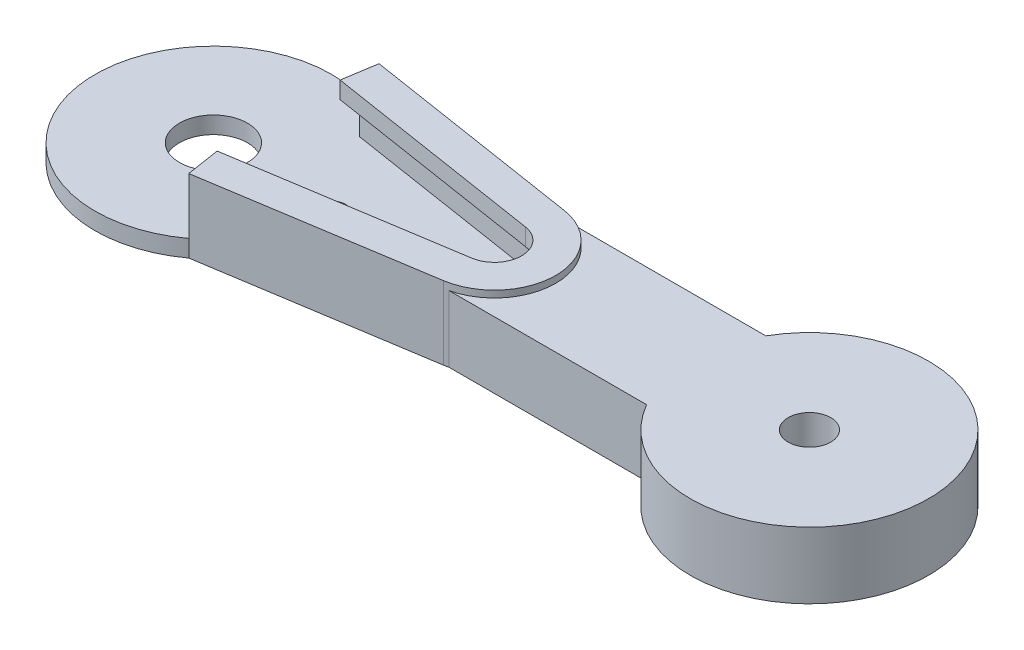
from build123d import *

# Parameters (mm, degrees)
SKETCH2_R           = 6
SKETCH2_R_2         = 1.5
BOSS_EXTRUDE1_DEPTH = 1.15
SKETCH3_R           = 4.4
BOSS_EXTRUDE2_DEPTH = 3.2
SKETCH4_R           = 0.75
BOSS_EXTRUDE3_DEPTH = 1.15
CIRPATTERN1_COUNT   = 2
BOSS_EXTRUDE5_DEPTH = 2.3
SKETCH7_R           = 2
BOSS_EXTRUDE6_DEPTH = 1
SKETCH10_R          = 0.75
CUT_EXTRUDE2_DEPTH  = 23.239726126
CUT_EXTRUDE4_DEPTH  = 2.3
SKETCH13_R          = 4.4
CUT_EXTRUDE5_DEPTH  = 3.3
BOSS_EXTRUDE8_DEPTH = 1
SKETCH14_R          = 1.25
BOSS_EXTRUDE9_DEPTH = 3.9


with BuildPart() as part:
    # Sketch2 → Boss-Extrude1 (new, symmetric)
    with BuildSketch(Plane(origin=(0, 0, 0), x_dir=(1, 0, 0), z_dir=(0, 1, 0))):
        Circle(SKETCH2_R)
        Circle(SKETCH2_R_2, mode=Mode.SUBTRACT)
    extrude(amount=BOSS_EXTRUDE1_DEPTH, both=True)

    # Sketch3 → Boss-Extrude2 (add)
    with BuildSketch(Plane(origin=(0, 1.15, 0), x_dir=(1, 0, 0), z_dir=(0, 1, 0))):
        Circle(SKETCH3_R)
        with BuildLine():
            Line((0.107421435, 2.898009771), (0.338399731, 2.678709694))
            Line((0.338399731, 2.678709694), (0.61665913, 2.83367809))
            ThreePointArc((0.61665913, 2.83367809), (0.721200673, 2.808891167), (0.824752316, 2.780248841))
            Line((0.824752316, 2.780248841), (0.993936292, 2.510396512))
            Line((0.993936292, 2.510396512), (1.301992734, 2.591295993))
            ThreePointArc((1.301992734, 2.591295993), (1.397085655, 2.541289372), (1.490260976, 2.48779465))
            Line((1.490260976, 2.48779465), (1.587020181, 2.184345885))
            Line((1.587020181, 2.184345885), (1.905517346, 2.186093238))
            ThreePointArc((1.905517346, 2.186093238), (1.985186607, 2.11400902), (2.062131058, 2.039023173))
            Line((2.062131058, 2.039023173), (2.080385755, 1.721044772))
            Line((2.080385755, 1.721044772), (2.389311295, 1.643530205))
            ThreePointArc((2.389311295, 1.643530205), (2.448550984, 1.553897705), (2.504429862, 1.46213237))
            Line((2.504429862, 1.46213237), (2.443033042, 1.149604087))
            Line((2.443033042, 1.149604087), (2.722976028, 0.997698125))
            ThreePointArc((2.722976028, 0.997698125), (2.758063897, 0.896149284), (2.789366126, 0.793370413))
            Line((2.789366126, 0.793370413), (2.652175577, 0.505929549))
            Line((2.652175577, 0.505929549), (2.885546163, 0.289177003))
            ThreePointArc((2.885546163, 0.289177003), (2.894277512, 0.182092507), (2.899036259, 0.074758075))
            Line((2.899036259, 0.074758075), (2.694672167, -0.169534403))
            Line((2.694672167, -0.169534403), (2.866806821, -0.437514174))
            ThreePointArc((2.866806821, -0.437514174), (2.848633027, -0.543405812), (2.826549281, -0.648551587))
            Line((2.826549281, -0.648551587), (2.567852594, -0.834345885))
            Line((2.567852594, -0.834345885), (2.667935462, -1.136714727))
            ThreePointArc((2.667935462, -1.136714727), (2.623998452, -1.234759946), (2.576459817, -1.331110368))
            Line((2.576459817, -1.331110368), (2.279685399, -1.446732346))
            Line((2.279685399, -1.446732346), (2.301427906, -1.764491312))
            ThreePointArc((2.301427906, -1.764491312), (2.234488404, -1.84852957), (2.164481907, -1.930030589))
            Line((2.164481907, -1.930030589), (1.848277186, -1.968215294))
            Line((1.848277186, -1.968215294), (1.790313171, -2.281398419))
            ThreePointArc((1.790313171, -2.281398419), (1.704577232, -2.346149284), (1.616501638, -2.40767989))
            Line((1.616501638, -2.40767989), (1.30073492, -2.366028036))
            Line((1.30073492, -2.366028036), (1.166706475, -2.654956874))
            ThreePointArc((1.166706475, -2.654956874), (1.067561203, -2.696351809), (0.966950626, -2.734045809))
            Line((0.966950626, -2.734045809), (0.671462695, -2.615174535))
            Line((0.671462695, -2.615174535), (0.469791321, -2.861694623))
            ThreePointArc((0.469791321, -2.861694623), (0.363466377, -2.877132634), (0.25664255, -2.888621575))
            Line((0.25664255, -2.888621575), (0, -2.7))
            Line((0, -2.7), (-0.25664255, -2.888621575))
            ThreePointArc((-0.25664255, -2.888621575), (-0.363466377, -2.877132634), (-0.469791321, -2.861694623))
            Line((-0.469791321, -2.861694623), (-0.671462695, -2.615174535))
            Line((-0.671462695, -2.615174535), (-0.966950626, -2.734045809))
            ThreePointArc((-0.966950626, -2.734045809), (-1.067561203, -2.696351809), (-1.166706475, -2.654956874))
            Line((-1.166706475, -2.654956874), (-1.30073492, -2.366028036))
            Line((-1.30073492, -2.366028036), (-1.616501638, -2.40767989))
            ThreePointArc((-1.616501638, -2.40767989), (-1.704577232, -2.346149284), (-1.790313171, -2.281398419))
            Line((-1.790313171, -2.281398419), (-1.848277186, -1.968215294))
            Line((-1.848277186, -1.968215294), (-2.164481907, -1.930030589))
            ThreePointArc((-2.164481907, -1.930030589), (-2.234488404, -1.84852957), (-2.301427906, -1.764491312))
            Line((-2.301427906, -1.764491312), (-2.279685399, -1.446732346))
            Line((-2.279685399, -1.446732346), (-2.576459817, -1.331110368))
            ThreePointArc((-2.576459817, -1.331110368), (-2.623998452, -1.234759946), (-2.667935462, -1.136714727))
            Line((-2.667935462, -1.136714727), (-2.567852594, -0.834345885))
            Line((-2.567852594, -0.834345885), (-2.826549281, -0.648551587))
            ThreePointArc((-2.826549281, -0.648551587), (-2.848633027, -0.543405812), (-2.866806821, -0.437514174))
            Line((-2.866806821, -0.437514174), (-2.694672167, -0.169534403))
            Line((-2.694672167, -0.169534403), (-2.899036259, 0.074758075))
            ThreePointArc((-2.899036259, 0.074758075), (-2.894277512, 0.182092507), (-2.885546163, 0.289177003))
            Line((-2.885546163, 0.289177003), (-2.652175577, 0.505929549))
            Line((-2.652175577, 0.505929549), (-2.789366126, 0.793370413))
            ThreePointArc((-2.789366126, 0.793370413), (-2.758063897, 0.896149284), (-2.722976028, 0.997698125))
            Line((-2.722976028, 0.997698125), (-2.443033042, 1.149604087))
            Line((-2.443033042, 1.149604087), (-2.504429862, 1.46213237))
            ThreePointArc((-2.504429862, 1.46213237), (-2.448550984, 1.553897705), (-2.389311295, 1.643530205))
            Line((-2.389311295, 1.643530205), (-2.080385755, 1.721044772))
            Line((-2.080385755, 1.721044772), (-2.062131058, 2.039023173))
            ThreePointArc((-2.062131058, 2.039023173), (-1.985186607, 2.11400902), (-1.905517346, 2.186093238))
            Line((-1.905517346, 2.186093238), (-1.587020181, 2.184345885))
            Line((-1.587020181, 2.184345885), (-1.490260976, 2.48779465))
            ThreePointArc((-1.490260976, 2.48779465), (-1.397085655, 2.541289372), (-1.301992734, 2.591295993))
            Line((-1.301992734, 2.591295993), (-0.993936292, 2.510396512))
            Line((-0.993936292, 2.510396512), (-0.824752316, 2.780248841))
            ThreePointArc((-0.824752316, 2.780248841), (-0.721200673, 2.808891167), (-0.61665913, 2.83367809))
            Line((-0.61665913, 2.83367809), (-0.338399731, 2.678709694))
            Line((-0.338399731, 2.678709694), (-0.107421435, 2.898009771))
            ThreePointArc((-0.107421435, 2.898009771), (0, 2.9), (0.107421435, 2.898009771))
        make_face(mode=Mode.SUBTRACT)
    extrude(amount=BOSS_EXTRUDE2_DEPTH)

    # Sketch4 → Boss-Extrude3 (add, symmetric)
    with BuildSketch(Plane(origin=(0, 0, 0), x_dir=(1, 0, 0), z_dir=(0, 1, 0))):
        with BuildLine():
            Line((3.968626967, 4.5), (16.888114198, 2.469689731))
            ThreePointArc((16.888114198, 2.469689731), (19, 0), (16.888114198, -2.469689731))
            Line((16.888114198, -2.469689731), (3.968626967, -4.5))
            ThreePointArc((3.968626967, -4.5), (6, 0), (3.968626967, 4.5))
        make_face()
        with Locations((16, 0)):
            Circle(SKETCH4_R, mode=Mode.SUBTRACT)
        with Locations((13, 0)):
            Circle(SKETCH4_R, mode=Mode.SUBTRACT)
        with Locations((10, 0)):
            Circle(SKETCH4_R, mode=Mode.SUBTRACT)
        with Locations((7, 0)):
            Circle(SKETCH4_R, mode=Mode.SUBTRACT)
    boss_extrude3 = extrude(amount=BOSS_EXTRUDE3_DEPTH, both=True)

    # CirPattern1: Boss-Extrude3 ×2 about axis
    cirpattern1_axis = Axis((0, 4.35, 0), (0, 1, 0))
    for i in range(1, CIRPATTERN1_COUNT):
        add(boss_extrude3.rotate(cirpattern1_axis, i * 360 / CIRPATTERN1_COUNT))



with BuildPart() as body_2:
    # Sketch6 → Boss-Extrude5 (new body)
    with BuildSketch(Plane.XZ.offset(1.15)):
        with BuildLine():
            Line((3.984151535, 4.598787589), (16.903638766, 2.568477321))
            ThreePointArc((16.903638766, 2.568477321), (19.1, 0), (16.903638766, -2.568477321))
            Line((16.903638766, -2.568477321), (3.984151535, -4.598787589))
            Line((3.984151535, -4.598787589), (4.139397214, -5.586663482))
            Line((4.139397214, -5.586663482), (17.058884445, -3.556353213))
            ThreePointArc((17.058884445, -3.556353213), (20.1, 0), (17.058884445, 3.556353213))
            Line((17.058884445, 3.556353213), (4.139397214, 5.586663482))
            Line((4.139397214, 5.586663482), (3.984151535, 4.598787589))
        make_face()
    extrude(amount=-BOSS_EXTRUDE5_DEPTH)


with BuildPart() as part_1:
    add(part.part)

    add(body_2.part)  # Boss-Extrude6 merges body 2
    # Sketch7 → Boss-Extrude6 (add)
    with BuildSketch(Plane.XZ.offset(1.15)):
        with BuildLine():
            Line((4.139397214, -5.586663482), (17.058884445, -3.556353213))
            ThreePointArc((17.058884445, -3.556353213), (20.1, 0), (17.058884445, 3.556353213))
            Line((17.058884445, 3.556353213), (4.139397214, 5.586663482))
            ThreePointArc((4.139397214, 5.586663482), (-6.953086951, 0), (4.139397214, -5.586663482))
        make_face()
        Circle(SKETCH7_R, mode=Mode.SUBTRACT)
    extrude(amount=BOSS_EXTRUDE6_DEPTH)

    # Sketch10 → Cut-Extrude2 (cut, through all)
    with BuildSketch(Plane.XZ.offset(2.15)):
        with Locations((7, 0)):
            Circle(SKETCH10_R)
        with Locations((16, 0)):
            Circle(SKETCH10_R)
        with Locations((13, 0)):
            Circle(SKETCH10_R)
        with Locations((10, 0)):
            Circle(SKETCH10_R)
    extrude(amount=-CUT_EXTRUDE2_DEPTH, mode=Mode.SUBTRACT)

    # Sketch12 → Cut-Extrude4 (cut)
    with BuildSketch(Plane(origin=(0, 1.15, 0), x_dir=(1, 0, 0), z_dir=(0, 1, 0))):
        with BuildLine():
            Line((-3.968626967, 4.5), (-16.888114198, 2.469689731))
            ThreePointArc((-16.888114198, 2.469689731), (-19, 0), (-16.888114198, -2.469689731))
            Line((-16.888114198, -2.469689731), (-3.968626967, -4.5))
            ThreePointArc((-3.968626967, -4.5), (0, -6), (3.968626967, -4.5))
            Line((3.968626967, -4.5), (16.888114198, -2.469689731))
            ThreePointArc((16.888114198, -2.469689731), (19, 0), (16.888114198, 2.469689731))
            Line((16.888114198, 2.469689731), (3.968626967, 4.5))
            ThreePointArc((3.968626967, 4.5), (0, 6), (-3.968626967, 4.5))
        make_face()
    extrude(amount=-CUT_EXTRUDE4_DEPTH, mode=Mode.SUBTRACT)


with BuildPart() as cut_extrude4_piece_1:
    # of the separate pieces the step leaves, piece 1, a body of its own (cut_extrude4_pieces)
    add(part_1.part.solids().sort_by_distance((4.139397214, -1.15, -5.586663482))[0])

    # Sketch9 → Boss-Extrude8 (add)
    with BuildSketch(Plane(origin=(0, 1.15, 0), x_dir=(1, 0, 0), z_dir=(0, 1, 0))):
        with BuildLine():
            Line((16.748393087, -1.580601428), (3.828905855, -3.610911697))
            Line((3.828905855, -3.610911697), (4.139397214, -5.586663482))
            Line((4.139397214, -5.586663482), (17.058884445, -3.556353213))
            ThreePointArc((17.058884445, -3.556353213), (20.1, 0), (17.058884445, 3.556353213))
            Line((17.058884445, 3.556353213), (4.139397214, 5.586663482))
            Line((4.139397214, 5.586663482), (3.828905855, 3.610911697))
            Line((3.828905855, 3.610911697), (16.748393087, 1.580601428))
            ThreePointArc((16.748393087, 1.580601428), (18.1, 0), (16.748393087, -1.580601428))
        make_face()
    extrude(amount=BOSS_EXTRUDE8_DEPTH)

    # Sketch14 → Boss-Extrude9 (add)
    with BuildSketch(Plane.XZ.offset(2.15)):
        with BuildLine():
            ThreePointArc((17.342614977, 3.5), (20.1, 0), (17.342614977, -3.5))
            Line((17.342614977, -3.5), (28.937822174, -3.5))
            ThreePointArc((28.937822174, -3.5), (42, 0), (28.937822174, 3.5))
            Line((28.937822174, 3.5), (17.342614977, 3.5))
        make_face()
        with Locations((35, 0)):
            Circle(SKETCH14_R, mode=Mode.SUBTRACT)
    extrude(amount=-BOSS_EXTRUDE9_DEPTH)


with BuildPart() as cut_extrude4_piece_2:
    # of the separate pieces the step leaves, piece 2, a body of its own (cut_extrude4_pieces)
    add(part_1.part.solids().sort_by_distance((4.4, 1.15, 0))[0])

    # Sketch13 → Cut-Extrude5 (cut)
    with BuildSketch(Plane(origin=(0, 4.35, 0), x_dir=(1, 0, 0), z_dir=(0, 1, 0))):
        Circle(SKETCH13_R)
    extrude(amount=-CUT_EXTRUDE5_DEPTH, mode=Mode.SUBTRACT)


solid = cut_extrude4_piece_1.part
